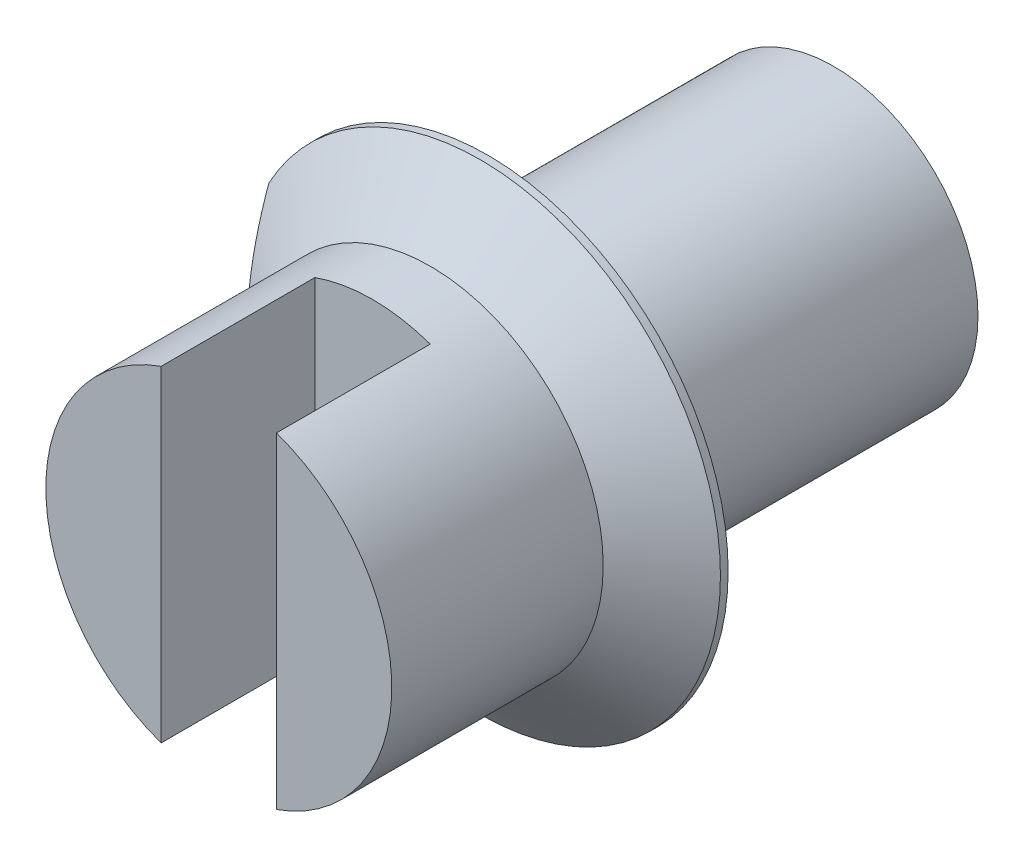
from build123d import *

# Parameters (mm, degrees)
SKETCH1_R               = 0.375
BOSS_EXTRUDE1_DEPTH     = 0.9
SKETCH2_R               = 0.625
BOSS_EXTRUDE2_DEPTH     = 0.15
SKETCH3_R               = 0.45
BOSS_EXTRUDE3_DEPTH     = 0.55
SKETCH4_W               = 0.3
SKETCH4_H               = 1.514088174
CUT_EXTRUDE1_DEPTH      = 0.4
CHAMFER1_SIZE           = 0.13
CHAMFER1_SIZE_2         = 0.175
CUT_EXTRUDE2_DEPTH      = 2.261447581
CUT_EXTRUDE2_DEPTH_BACK = 2.261447581
SKETCH5_W               = 0.405583523
SKETCH5_H               = 1.586532149


with BuildPart() as part:
    # Sketch1 → Boss-Extrude1 (new body)
    with BuildSketch(Plane.XY):
        Circle(SKETCH1_R)
    extrude(amount=-BOSS_EXTRUDE1_DEPTH)

    # Sketch2 → Boss-Extrude2 (add)
    with BuildSketch(Plane.XY):
        Circle(SKETCH2_R)
    extrude(amount=BOSS_EXTRUDE2_DEPTH)

    # Sketch3 → Boss-Extrude3 (add)
    with BuildSketch(Plane.XY.offset(0.15)):
        Circle(SKETCH3_R)
    extrude(amount=BOSS_EXTRUDE3_DEPTH)

    # Sketch4 → Cut-Extrude1 (cut)
    with BuildSketch(Plane.XY.offset(0.7)):
        with Locations((0, -0.021514413)):
            Rectangle(SKETCH4_W, SKETCH4_H)
    extrude(amount=-CUT_EXTRUDE1_DEPTH, mode=Mode.SUBTRACT)

    # Chamfer1
    # the kernel refuses this chamfer: 0.175, 0.13 mm, written as the material it takes off along each edge
    with BuildSketch(Plane(origin=(0, 0, 0.15), x_dir=(1, 0, 0), z_dir=(0, -1, 0))) as chamfer1_piece_1_section:
        Polygon((0.625, -CHAMFER1_SIZE), (0.625 - CHAMFER1_SIZE_2, 0), (0.625, 0), align=None)
    chamfer1_piece_1 = revolve(axis=Axis((0, 0, 0.15), (0, 0, 1)), mode=Mode.PRIVATE)
    chamfer1_piece_1 = chamfer1_piece_1 - Plane(origin=(0, 0, 0.085771978), x_dir=(1, 0, 0), z_dir=(0, 0, -1)) * Cylinder(0.45, 3, mode=Mode.PRIVATE)
    add(chamfer1_piece_1, mode=Mode.SUBTRACT)

    # Sketch5 → Cut-Extrude2 (cut, two sides: drawn at the far end of the back side and taken through both)
    with BuildSketch(Plane.XY.offset(-CUT_EXTRUDE2_DEPTH_BACK)):
        with Locations((-0.752791762, 0.000920374)):
            Rectangle(SKETCH5_W, SKETCH5_H)
    extrude(amount=CUT_EXTRUDE2_DEPTH + CUT_EXTRUDE2_DEPTH_BACK, mode=Mode.SUBTRACT)


solid = part.part
